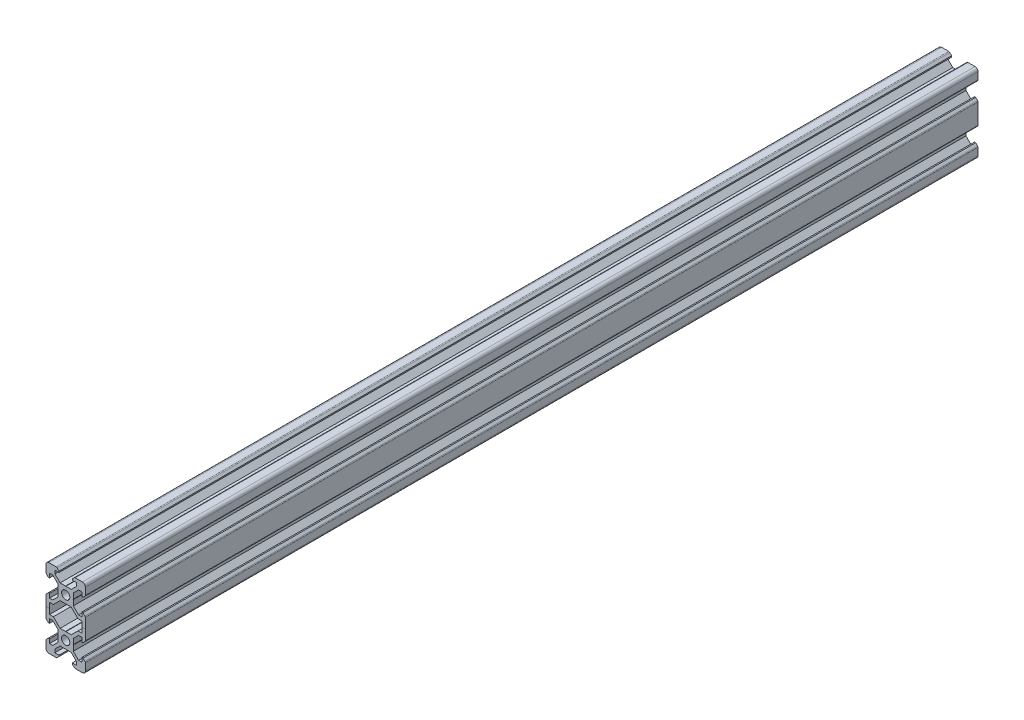
from build123d import *

# Parameters (mm, degrees)
SKETCH1_R           = 2.1
BOSS_EXTRUDE2_DEPTH = 454


with BuildPart() as part:
    # Sketch1 → Boss-Extrude2 (new body)
    with BuildSketch(Plane.XY):
        with BuildLine():
            Line((-8.5, 10), (-4.862792737, 10))
            ThreePointArc((-4.862792737, 10), (-4.598292737, 9.947387679), (-4.374060464, 9.797560464))
            Line((-4.374060464, 9.797560464), (-3.3865, 8.81))
            Line((-3.3865, 8.81), (-3.3865, 8.2))
            Line((-3.3865, 8.2), (-5.5, 8.2))
            Line((-5.5, 8.2), (-5.5, 6.561))
            Line((-5.5, 6.561), (-2.8395, 3.9005))
            Line((-2.8395, 3.9005), (-0.1, 3.9005))
            Line((-0.1, 3.9005), (0, 3.8005))
            Line((0, 3.8005), (0.1, 3.9005))
            Line((0.1, 3.9005), (2.8395, 3.9005))
            Line((2.8395, 3.9005), (5.5, 6.561))
            Line((5.5, 6.561), (5.5, 8.2))
            Line((5.5, 8.2), (3.3865, 8.2))
            Line((3.3865, 8.2), (3.3865, 8.81))
            Line((3.3865, 8.81), (4.374060464, 9.797560464))
            ThreePointArc((4.374060464, 9.797560464), (4.598292737, 9.947387679), (4.862792737, 10))
            Line((4.862792737, 10), (8.5, 10))
            ThreePointArc((8.5, 10), (9.560660172, 9.560660172), (10, 8.5))
            Line((10, 8.5), (10, 4.862792737))
            ThreePointArc((10, 4.862792737), (9.947387679, 4.598292737), (9.797560464, 4.374060464))
            Line((9.797560464, 4.374060464), (8.81, 3.3865))
            Line((8.81, 3.3865), (8.2, 3.3865))
            Line((8.2, 3.3865), (8.2, 5.5))
            Line((8.2, 5.5), (6.561, 5.5))
            Line((6.561, 5.5), (3.9005, 2.8395))
            Line((3.9005, 2.8395), (3.9005, 0.1))
            Line((3.9005, 0.1), (3.8005, 0))
            Line((3.8005, 0), (3.9005, -0.1))
            Line((3.9005, -0.1), (3.9005, -2.8395))
            Line((3.9005, -2.8395), (6.561, -5.5))
            Line((6.561, -5.5), (8.2, -5.5))
            Line((8.2, -5.5), (8.2, -3.3865))
            Line((8.2, -3.3865), (8.81, -3.3865))
            Line((8.81, -3.3865), (9.797560464, -4.374060464))
            ThreePointArc((9.797560464, -4.374060464), (9.947387679, -4.598292737), (10, -4.862792737))
            Line((10, -4.862792737), (10, -15.137207263))
            ThreePointArc((10, -15.137207263), (9.947387679, -15.401707263), (9.797560464, -15.625939536))
            Line((9.797560464, -15.625939536), (8.81, -16.6135))
            Line((8.81, -16.6135), (8.2, -16.6135))
            Line((8.2, -16.6135), (8.2, -14.5))
            Line((8.2, -14.5), (6.561, -14.5))
            Line((6.561, -14.5), (3.9005, -17.1605))
            Line((3.9005, -17.1605), (3.9005, -19.9))
            Line((3.9005, -19.9), (3.8005, -20))
            Line((3.8005, -20), (3.9005, -20.1))
            Line((3.9005, -20.1), (3.9005, -22.8395))
            Line((3.9005, -22.8395), (6.561, -25.5))
            Line((6.561, -25.5), (8.2, -25.5))
            Line((8.2, -25.5), (8.2, -23.3865))
            Line((8.2, -23.3865), (8.81, -23.3865))
            Line((8.81, -23.3865), (9.797560464, -24.374060464))
            ThreePointArc((9.797560464, -24.374060464), (9.947387679, -24.598292737), (10, -24.862792737))
            Line((10, -24.862792737), (10, -28.5))
            ThreePointArc((10, -28.5), (9.560660172, -29.560660172), (8.5, -30))
            Line((8.5, -30), (4.862792737, -30))
            ThreePointArc((4.862792737, -30), (4.598292737, -29.947387679), (4.374060464, -29.797560464))
            Line((4.374060464, -29.797560464), (3.3865, -28.81))
            Line((3.3865, -28.81), (3.3865, -28.2))
            Line((3.3865, -28.2), (5.5, -28.2))
            Line((5.5, -28.2), (5.5, -26.561))
            Line((5.5, -26.561), (2.8395, -23.9005))
            Line((2.8395, -23.9005), (0.1, -23.9005))
            Line((0.1, -23.9005), (0, -23.8005))
            Line((0, -23.8005), (-0.1, -23.9005))
            Line((-0.1, -23.9005), (-2.8395, -23.9005))
            Line((-2.8395, -23.9005), (-5.5, -26.561))
            Line((-5.5, -26.561), (-5.5, -28.2))
            Line((-5.5, -28.2), (-3.3865, -28.2))
            Line((-3.3865, -28.2), (-3.3865, -28.81))
            Line((-3.3865, -28.81), (-4.374060464, -29.797560464))
            ThreePointArc((-4.374060464, -29.797560464), (-4.598292737, -29.947387679), (-4.862792737, -30))
            Line((-4.862792737, -30), (-8.5, -30))
            ThreePointArc((-8.5, -30), (-9.560660172, -29.560660172), (-10, -28.5))
            Line((-10, -28.5), (-10, -24.862792737))
            ThreePointArc((-10, -24.862792737), (-9.947387679, -24.598292737), (-9.797560464, -24.374060464))
            Line((-9.797560464, -24.374060464), (-8.81, -23.3865))
            Line((-8.81, -23.3865), (-8.2, -23.3865))
            Line((-8.2, -23.3865), (-8.2, -25.5))
            Line((-8.2, -25.5), (-6.561, -25.5))
            Line((-6.561, -25.5), (-3.9005, -22.8395))
            Line((-3.9005, -22.8395), (-3.9005, -20.1))
            Line((-3.9005, -20.1), (-3.8005, -20))
            Line((-3.8005, -20), (-3.9005, -19.9))
            Line((-3.9005, -19.9), (-3.9005, -17.1605))
            Line((-3.9005, -17.1605), (-6.561, -14.5))
            Line((-6.561, -14.5), (-8.2, -14.5))
            Line((-8.2, -14.5), (-8.2, -16.6135))
            Line((-8.2, -16.6135), (-8.81, -16.6135))
            Line((-8.81, -16.6135), (-9.797560464, -15.625939536))
            ThreePointArc((-9.797560464, -15.625939536), (-9.947387679, -15.401707263), (-10, -15.137207263))
            Line((-10, -15.137207263), (-10, -4.862792737))
            ThreePointArc((-10, -4.862792737), (-9.947387679, -4.598292737), (-9.797560464, -4.374060464))
            Line((-9.797560464, -4.374060464), (-8.81, -3.3865))
            Line((-8.81, -3.3865), (-8.2, -3.3865))
            Line((-8.2, -3.3865), (-8.2, -5.5))
            Line((-8.2, -5.5), (-6.561, -5.5))
            Line((-6.561, -5.5), (-3.9005, -2.8395))
            Line((-3.9005, -2.8395), (-3.9005, -0.1))
            Line((-3.9005, -0.1), (-3.8005, 0))
            Line((-3.8005, 0), (-3.9005, 0.1))
            Line((-3.9005, 0.1), (-3.9005, 2.8395))
            Line((-3.9005, 2.8395), (-6.561, 5.5))
            Line((-6.561, 5.5), (-8.2, 5.5))
            Line((-8.2, 5.5), (-8.2, 3.3865))
            Line((-8.2, 3.3865), (-8.81, 3.3865))
            Line((-8.81, 3.3865), (-9.797560464, 4.374060464))
            ThreePointArc((-9.797560464, 4.374060464), (-9.947387679, 4.598292737), (-10, 4.862792737))
            Line((-10, 4.862792737), (-10, 8.5))
            ThreePointArc((-10, 8.5), (-9.560660172, 9.560660172), (-8.5, 10))
        make_face()
        Circle(SKETCH1_R, mode=Mode.SUBTRACT)
        with Locations((0, -20)):
            Circle(SKETCH1_R, mode=Mode.SUBTRACT)
        Polygon((-8.2, -12.7), (-8.2, -7.3), (-6.239, -7.3), (-5.5, -6.561), (-2.8395, -3.9005), (-0.1, -3.9005), (0, -3.8005), (0.1, -3.9005), (2.8395, -3.9005), (5.5, -6.561), (6.239, -7.3), (8.2, -7.3), (8.2, -12.7), (6.239, -12.7), (5.5, -13.439), (2.8395, -16.0995), (0.1, -16.0995), (0, -16.1995), (-0.1, -16.0995), (-2.8395, -16.0995), (-5.5, -13.439), (-6.239, -12.7), align=None, mode=Mode.SUBTRACT)
    extrude(amount=BOSS_EXTRUDE2_DEPTH)


solid = part.part
